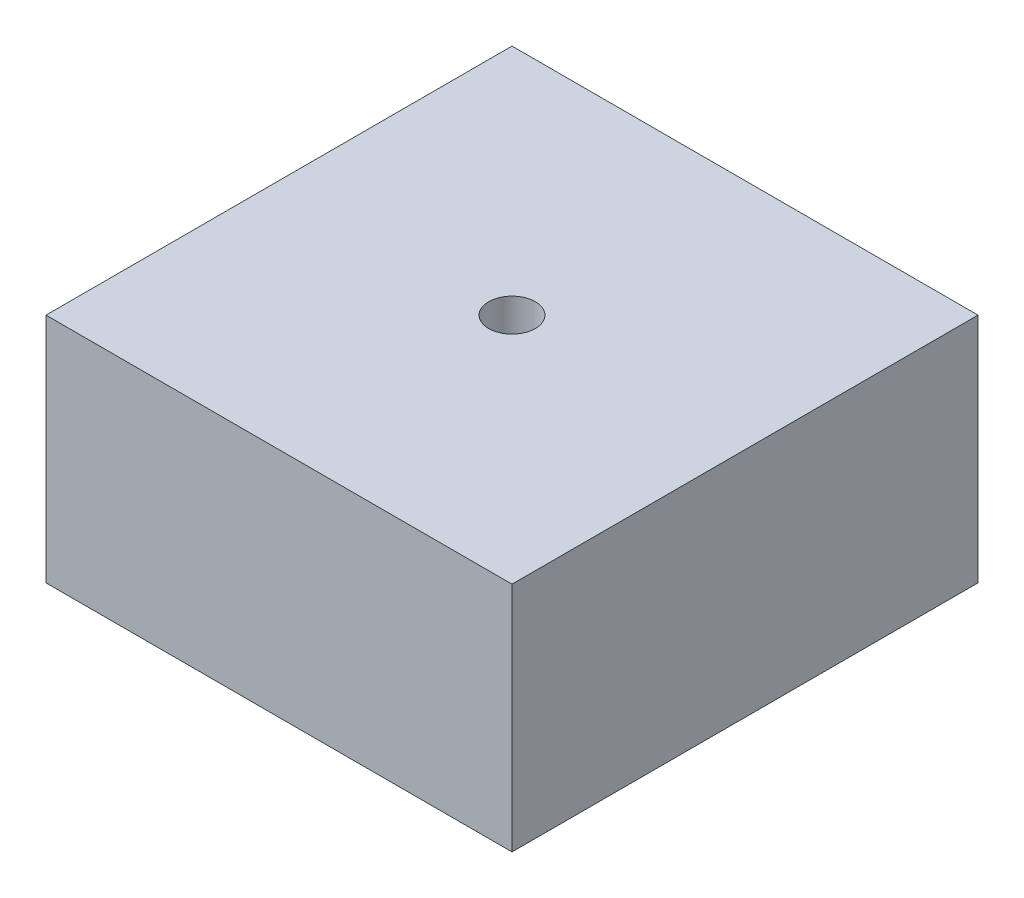
from build123d import *

# Parameters (mm, degrees)
SKETCH1_W           = 100
SKETCH1_H           = 100
BOSS_EXTRUDE1_DEPTH = 49.7625
SKETCH2_R           = 5
CUT_EXTRUDE1_DEPTH  = 87.465637141


with BuildPart() as part:
    # Sketch1 → Boss-Extrude1 (new body)
    with BuildSketch(Plane(origin=(0, -12.5, 0), x_dir=(1, 0, 0), z_dir=(0, 1, 0))):
        Rectangle(SKETCH1_W, SKETCH1_H)
    extrude(amount=BOSS_EXTRUDE1_DEPTH)

    # Sketch2 → Cut-Extrude1 (cut, through all)
    with BuildSketch(Plane(origin=(0, 37.2625, 0), x_dir=(-1, 0, 0), z_dir=(0, 1, 0))):
        Circle(SKETCH2_R)
    extrude(amount=-CUT_EXTRUDE1_DEPTH, mode=Mode.SUBTRACT)


solid = part.part
